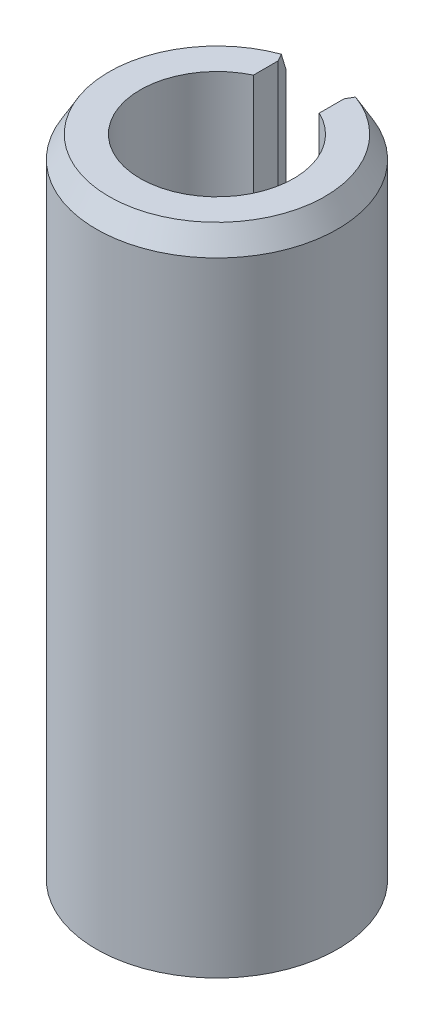
from build123d import *
from OCP.BRepFilletAPI import BRepFilletAPI_MakeChamfer

# Parameters (mm, degrees)
ESBO_O1_R                = 2.75
ESBO_O1_R_2              = 1.75
RESSALTO_EXTRUS_O1_DEPTH = 15
ESBO_O2_W                = 1.5
ESBO_O2_H                = 2.767894019
CORTE_EXTRUS_O1_DEPTH    = 16.495967217
CHANFRO1_SIZE            = 0.5
CHANFRO2_SIZE            = 0.5
CHANFRO2_SIZE2           = 0.288675135


with BuildPart() as part:
    # Esboço1 → Ressalto-extrusão1 (new body)
    with BuildSketch(Plane(origin=(0, 0, 0), x_dir=(1, 0, 0), z_dir=(0, 1, 0))):
        with Locations(Location((0, 0, 0), (0, 0, 270))):
            Circle(ESBO_O1_R)
        with Locations(Location((0, 0, 0), (0, 0, 270))):
            Circle(ESBO_O1_R_2, mode=Mode.SUBTRACT)
    extrude(amount=RESSALTO_EXTRUS_O1_DEPTH)

    # Esboço2 → Corte-extrusão1 (cut, through all)
    with BuildSketch(Plane(origin=(0, 15, 0), x_dir=(1, 0, 0), z_dir=(0, 1, 0))):
        with Locations((0, 1.747513295)):
            Rectangle(ESBO_O2_W, ESBO_O2_H)
    extrude(amount=-CORTE_EXTRUS_O1_DEPTH, mode=Mode.SUBTRACT)

    # Chanfro1
    # the kernel refuses this chamfer: 0.5, 0.257849129 mm, written as the material it takes off along each edge
    with BuildSketch(Plane(origin=(-0.75, 16.293542877, -2.645751311), x_dir=(-0.9484043695289113, 0, 0.3170633246821023), z_dir=(0, -1, 0))) as chanfro1_piece_1:
        with BuildLine():
            Line((0.25513486, 0), (CHANFRO1_SIZE * 0.317063324682, -CHANFRO1_SIZE * 0.948404369529))
            Line((CHANFRO1_SIZE * 0.317063324682, -CHANFRO1_SIZE * 0.948404369529), (0, 0))
            ThreePointArc((0, 0), (0.129558651, 0.002959681), (0.25513486, 0))
        make_face()
    extrude(amount=17.587085755, mode=Mode.SUBTRACT)
    with BuildSketch(Plane(origin=(0.75, 16.293542877, -2.645751311), x_dir=(0.948404369528912, 0, 0.3170633246821001), z_dir=(0, -1, 0))) as chanfro1_piece_2:
        with BuildLine():
            Line((0.25513486, 0), (CHANFRO1_SIZE * 0.317063324682, CHANFRO1_SIZE * 0.948404369529))
            Line((CHANFRO1_SIZE * 0.317063324682, CHANFRO1_SIZE * 0.948404369529), (0, 0))
            ThreePointArc((0, 0), (0.129558651, -0.002959681), (0.25513486, 0))
        make_face()
    extrude(amount=17.587085755, mode=Mode.SUBTRACT)

    # Chanfro2: one chamfer whose edges measure the first distance from different faces: ONE call of the kernel's chamfer builder (chamfer() names one face for all edges)
    chanfro2_edges_1 = [part.edges().sort_by_distance(p)[0] for p in [
        (0, 0, 2.75),
    ]]
    chanfro2_side_1 = [part.faces().sort_by_distance(p)[0] for p in [
        (-0.937222417, 0, -2.31706246),
    ]]
    chanfro2_edges_2 = [part.edges().sort_by_distance(p)[0] for p in [
        (0, 15, 2.75),
    ]]
    chanfro2_side_2 = [part.faces().sort_by_distance(p)[0] for p in [
        (0, 7.5, 2.75),
    ]]
    chanfro2 = BRepFilletAPI_MakeChamfer(part.part.solid().wrapped)
    for e in chanfro2_edges_1:
        chanfro2.Add(CHANFRO2_SIZE, CHANFRO2_SIZE2, e.wrapped, chanfro2_side_1[0].wrapped)  # the first distance lies on this face
    for e in chanfro2_edges_2:
        chanfro2.Add(CHANFRO2_SIZE, CHANFRO2_SIZE2, e.wrapped, chanfro2_side_2[0].wrapped)  # the first distance lies on this face
    add(Compound.cast(chanfro2.Shape()), mode=Mode.REPLACE)


solid = part.part
